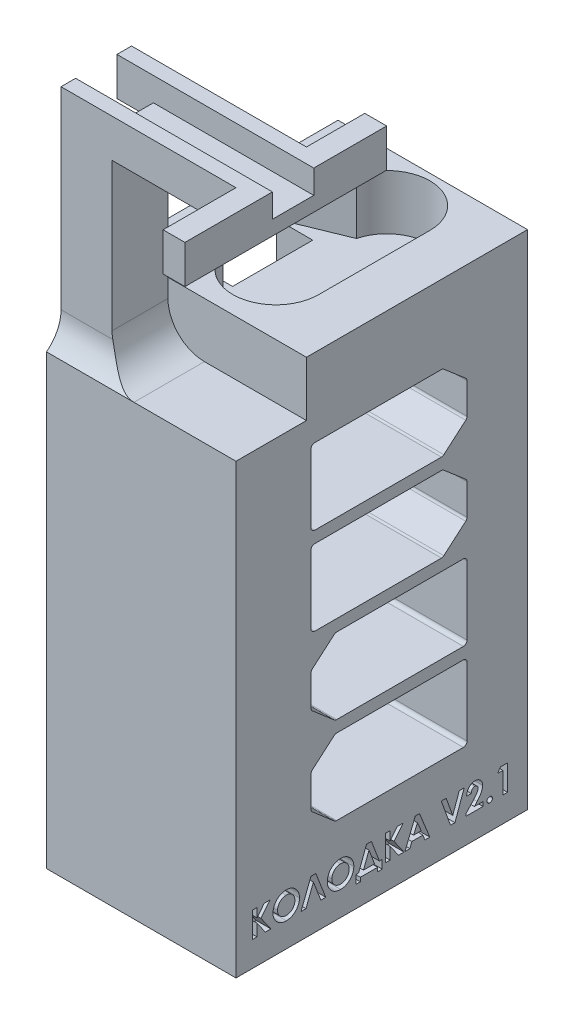
from build123d import *
from OCP.BRepAlgoAPI import BRepAlgoAPI_Cut
from OCP.TopTools import TopTools_ListOfShape

# Parameters (mm, degrees)
SKETCH_1_W          = 40
SKETCH_1_H          = 52.4
EXTRUDE_1_DEPTH     = 26
CUT_EXTRUDE_1_DEPTH = 5
CUT_EXTRUDE_2_DEPTH = 5
SKETCH_4_W          = 26
SKETCH_4_H          = 40
EXTRUDE_2_DEPTH     = 9
SKETCH_5_W          = 0.929999766
SKETCH_5_H          = 1.6
CUT_EXTRUDE_3_DEPTH = 5
CUT_EXTRUDE_4_DEPTH = 2
SKETCH_7_W          = 10.999999036
SKETCH_7_H          = 39.2
CUT_EXTRUDE_5_DEPTH = 5
SKETCH_8_W          = 10.07
SKETCH_8_H          = 9.796681171
CUT_EXTRUDE_6_DEPTH = 5
CUT_EXTRUDE_7_DEPTH = 5
EXTRUDE_3_DEPTH     = 7.52
SKETCH_12_W         = 3
SKETCH_12_H         = 59.4
EXTRUDE_4_DEPTH     = 5
EXTRUDE_5_DEPTH     = 27.25
FILLET_1_R          = 5
SKETCH_14_W         = 27
SKETCH_14_H         = 3.25
EXTRUDE_6_DEPTH     = 2
SKETCH_15_W         = 10
SKETCH_15_H         = 5.25
EXTRUDE_7_DEPTH     = 3
EXTRUDE_9_DEPTH     = 2
SKETCH_17_W         = 24
SKETCH_17_H         = 5.25
EXTRUDE_10_DEPTH    = 2


with BuildPart() as part:
    # Эскиз1 → Бобышка-Вытянуть1 (new body)
    with BuildSketch(Plane(origin=(0, 0, 0), x_dir=(0, 0, -1), z_dir=(1, 0, 0))):
        Rectangle(SKETCH_1_W, SKETCH_1_H)
        with BuildLine():
            Line((11.7, -10.900000099), (11.7, -1.500000099))
            ThreePointArc((11.7, -1.500000099), (11.553553391, -1.146446709), (11.2, -1.000000099))
            Line((11.2, -1.000000099), (-6.188803539, -1.000000099))
            ThreePointArc((-6.188803539, -1.000000099), (-6.362578004, -1.031169175), (-6.514686911, -1.120790358))
            Line((-6.514686911, -1.120790358), (-9.525883367, -3.708537312))
            ThreePointArc((-9.525883367, -3.708537312), (-9.654390627, -3.879110638), (-9.699999995, -4.087747071))
            Line((-9.699999995, -4.087747071), (-9.699999856, -8.312253158))
            ThreePointArc((-9.699999856, -8.312253158), (-9.654390483, -8.520889567), (-9.525883236, -8.691462875))
            Line((-9.525883236, -8.691462875), (-6.514686916, -11.279209833))
            ThreePointArc((-6.514686916, -11.279209833), (-6.362578006, -11.368831022), (-6.188803535, -11.400000099))
            Line((-6.188803535, -11.400000099), (11.2, -11.400000099))
            ThreePointArc((11.2, -11.400000099), (11.553553391, -11.25355349), (11.7, -10.900000099))
        make_face(mode=Mode.SUBTRACT)
        with BuildLine():
            Line((11.7, -22.9), (11.7, -13.5))
            ThreePointArc((11.7, -13.5), (11.553553391, -13.146446609), (11.2, -13))
            Line((11.2, -13), (-6.188803539, -13))
            ThreePointArc((-6.188803539, -13), (-6.362578004, -13.031169076), (-6.514686911, -13.120790258))
            Line((-6.514686911, -13.120790258), (-9.525883367, -15.708537213))
            ThreePointArc((-9.525883367, -15.708537213), (-9.654390627, -15.879110539), (-9.699999995, -16.087746971))
            Line((-9.699999995, -16.087746971), (-9.699999856, -20.312253058))
            ThreePointArc((-9.699999856, -20.312253058), (-9.654390483, -20.520889467), (-9.525883236, -20.691462776))
            Line((-9.525883236, -20.691462776), (-6.514686916, -23.279209734))
            ThreePointArc((-6.514686916, -23.279209734), (-6.362578006, -23.368830922), (-6.188803535, -23.4))
            Line((-6.188803535, -23.4), (11.2, -23.4))
            ThreePointArc((11.2, -23.4), (11.553553391, -23.253553391), (11.7, -22.9))
        make_face(mode=Mode.SUBTRACT)
        with BuildLine():
            Line((-9.699999995, 10.5), (-9.699999995, 1.1))
            ThreePointArc((-9.699999995, 1.1), (-9.553553386, 0.746446609), (-9.199999995, 0.6))
            Line((-9.199999995, 0.6), (8.188803544, 0.6))
            ThreePointArc((8.188803544, 0.6), (8.362578009, 0.631169076), (8.514686915, 0.720790258))
            Line((8.514686915, 0.720790258), (11.525883372, 3.308537213))
            ThreePointArc((11.525883372, 3.308537213), (11.654390632, 3.479110539), (11.7, 3.687746971))
            Line((11.7, 3.687746971), (11.69999986, 7.912253058))
            ThreePointArc((11.69999986, 7.912253058), (11.654390487, 8.120889467), (11.52588324, 8.291462776))
            Line((11.52588324, 8.291462776), (8.51468692, 10.879209734))
            ThreePointArc((8.51468692, 10.879209734), (8.36257801, 10.968830922), (8.18880354, 11))
            Line((8.18880354, 11), (-9.199999995, 11))
            ThreePointArc((-9.199999995, 11), (-9.553553386, 10.853553391), (-9.699999995, 10.5))
        make_face(mode=Mode.SUBTRACT)
        with BuildLine():
            Line((-9.699999995, 22.5), (-9.699999995, 13.1))
            ThreePointArc((-9.699999995, 13.1), (-9.553553386, 12.746446609), (-9.199999995, 12.6))
            Line((-9.199999995, 12.6), (8.188803544, 12.6))
            ThreePointArc((8.188803544, 12.6), (8.362578009, 12.631169076), (8.514686915, 12.720790258))
            Line((8.514686915, 12.720790258), (11.525883372, 15.308537213))
            ThreePointArc((11.525883372, 15.308537213), (11.654390632, 15.479110539), (11.7, 15.687746971))
            Line((11.7, 15.687746971), (11.69999986, 19.912253058))
            ThreePointArc((11.69999986, 19.912253058), (11.654390487, 20.120889467), (11.52588324, 20.291462776))
            Line((11.52588324, 20.291462776), (8.51468692, 22.879209734))
            ThreePointArc((8.51468692, 22.879209734), (8.36257801, 22.968830922), (8.18880354, 23))
            Line((8.18880354, 23), (-9.199999995, 23))
            ThreePointArc((-9.199999995, 23), (-9.553553386, 22.853553391), (-9.699999995, 22.5))
        make_face(mode=Mode.SUBTRACT)
    extrude(amount=EXTRUDE_1_DEPTH)

    # Эскиз2 → Вырез-Вытянуть1 (cut)
    with BuildSketch(Plane.ZY):
        with BuildLine():
            Line((-0.53499914, 17.800000005), (-0.535000075, -18.199999704))
            ThreePointArc((-0.535000075, -18.199999704), (4.500000262, -23.235000302), (9.53500086, -18.199999965))
            Line((9.53500086, -18.199999965), (9.535001795, 17.799999744))
            ThreePointArc((9.535001795, 17.799999744), (4.500001458, 22.835000342), (-0.53499914, 17.800000005))
        make_face()
    extrude(amount=-CUT_EXTRUDE_1_DEPTH, mode=Mode.SUBTRACT)

    # Эскиз3 → Вырез-Вытянуть2 (cut)
    with BuildSketch(Plane.ZY):
        with BuildLine():
            Line((-1.464999533, 5.799999501), (-1.464998168, 26.399999667))
            Line((-1.464998168, 26.399999667), (-11.534998963, 26.400000333))
            Line((-11.534998963, 26.400000333), (-11.535000327, 5.800000168))
            ThreePointArc((-11.535000327, 5.800000168), (-6.500000264, 0.764999437), (-1.464999533, 5.799999501))
        make_face()
    extrude(amount=-CUT_EXTRUDE_2_DEPTH, mode=Mode.SUBTRACT)

    # Эскиз4 → Бобышка-Вытянуть2 (add)
    with BuildSketch(Plane.XZ.offset(26.2)):
        with Locations((13, 0)):
            Rectangle(SKETCH_4_W, SKETCH_4_H)
    extrude(amount=EXTRUDE_2_DEPTH)

    # Эскиз5 → Вырез-Вытянуть3 (cut)
    with BuildSketch(Plane.ZY):
        with Locations((-0.999999199, 11.8)):
            Rectangle(SKETCH_5_W, SKETCH_5_H)
    extrude(amount=-CUT_EXTRUDE_3_DEPTH, mode=Mode.SUBTRACT)

    # Эскиз6 → Вырез-Вытянуть4 (cut)
    # profile 1 of 11: a face of its own
    with BuildSketch(Plane(origin=(26, 0, 0), x_dir=(0, 0, -1), z_dir=(1, 0, 0))):
        Polygon((-17.746794872, -28.261895698), (-17.118589744, -28.261895698), (-17.118589744, -29.493766691), (-16.125801282, -28.261895698), (-15.332832532, -28.261895698), (-16.580128205, -29.809972621), (-15.211538462, -31.761895698), (-15.968048878, -31.761895698), (-17.118589744, -30.120569576), (-17.118589744, -31.761895698), (-17.746794872, -31.761895698), align=None)
    # profile 2 of 11: a face of its own
    with BuildSketch(Plane(origin=(26, 0, 0), x_dir=(0, 0, -1), z_dir=(1, 0, 0))):
        with BuildLine():
            add(Edge.make_bspline(
                [(-13.095552885, -28.172152108), (-13.034701095, -28.17372767), (-12.91456588, -28.176838186), (-12.737890331, -28.202766763), (-12.567630772, -28.245013662), (-12.403864195, -28.303739908), (-12.247000651, -28.380536106), (-12.096486831, -28.473225033), (-11.952861868, -28.583556136), (-11.817597516, -28.708955575), (-11.692588859, -28.845321988), (-11.584268785, -28.992144676), (-11.491897399, -29.145619316), (-11.415339748, -29.306157146), (-11.357026846, -29.474869969), (-11.316106272, -29.650897571), (-11.28981683, -29.834189875), (-11.286793139, -29.958986951), (-11.28525641, -30.022412525)],
                knots=[0, 0, 0, 0, 1.014329547, 2.002516266, 2.970391464, 3.935626869, 4.897733899, 5.877609409, 6.878433252, 7.912639331, 8.949961323, 9.958554974, 10.949718813, 11.932905612, 12.9188844, 13.919928257, 14.942845884, 16, 16, 16, 16], degree=3))
            add(Edge.make_bspline(
                [(-11.28525641, -30.022412525), (-11.28689296, -30.085123438), (-11.290117834, -30.208697305), (-11.315033021, -30.390300498), (-11.356642704, -30.564442478), (-11.413966573, -30.73151742), (-11.489135758, -30.890716068), (-11.579705801, -31.043054886), (-11.688066673, -31.187120131), (-11.810266027, -31.322834494), (-11.944796912, -31.446024399), (-12.087286475, -31.554585291), (-12.237076788, -31.646575693), (-12.393948606, -31.721953471), (-12.558238332, -31.780451388), (-12.729540152, -31.821725919), (-12.907843464, -31.846809285), (-13.029098364, -31.850013095), (-13.090645032, -31.851639287)],
                knots=[0, 0, 0, 0, 1.051557043, 2.072126891, 3.067553643, 4.050577992, 5.02905126, 6.015227836, 7.017913613, 8.04756643, 9.074058332, 10.072836633, 11.047628519, 12.017157415, 12.98668631, 13.966869689, 14.968021931, 16, 16, 16, 16], degree=3))
            add(Edge.make_bspline(
                [(-13.090645032, -31.851639287), (-13.155015467, -31.850180513), (-13.281494574, -31.847314219), (-13.466597313, -31.82005708), (-13.643941731, -31.778998307), (-13.812038033, -31.71772029), (-13.972598136, -31.641117616), (-14.124442358, -31.546776831), (-14.267519669, -31.43485384), (-14.401009355, -31.308215032), (-14.521951333, -31.1696444), (-14.628706352, -31.023256815), (-14.718756578, -30.870170551), (-14.792105307, -30.710313959), (-14.849930499, -30.544680509), (-14.890719601, -30.372261445), (-14.914814698, -30.193470292), (-14.918171005, -30.072031767), (-14.919871795, -30.010493454)],
                knots=[0, 0, 0, 0, 1.067978421, 2.098431617, 3.099715153, 4.085208694, 5.062210972, 6.048429807, 7.046490867, 8.072918869, 9.098532598, 10.095778865, 11.076610158, 12.041847152, 13.011192615, 13.984257998, 14.978533688, 16, 16, 16, 16], degree=3))
            add(Edge.make_bspline(
                [(-14.919871795, -30.010493454), (-14.919337989, -29.969093699), (-14.918277136, -29.886818403), (-14.905498047, -29.764890616), (-14.887099833, -29.645342695), (-14.859889747, -29.52865128), (-14.826836448, -29.413993167), (-14.784011229, -29.302435623), (-14.73526454, -29.192786906), (-14.678308624, -29.086342105), (-14.614979153, -28.9840806), (-14.545881062, -28.886484778), (-14.470840604, -28.794734714), (-14.39009951, -28.708227465), (-14.303379534, -28.627531649), (-14.21182139, -28.551504905), (-14.113649381, -28.482166773), (-14.011012185, -28.417823877), (-13.904488447, -28.359639713), (-13.794511815, -28.310115092), (-13.683348025, -28.266866085), (-13.569512079, -28.232732056), (-13.454223931, -28.204930246), (-13.336251961, -28.186544432), (-13.216661979, -28.173765697), (-13.136018388, -28.172691247), (-13.095552885, -28.172152108)],
                knots=[0, 0, 0, 0, 1.034744296, 2.056386356, 3.06226378, 4.057406941, 5.050368692, 6.043467995, 7.042652155, 8.049140477, 9.059438543, 10.048523776, 11.036952808, 12.020949711, 13.004946614, 13.997082645, 14.994316842, 16.007702937, 17.024872941, 18.026463647, 19.021641123, 20.005082605, 20.995858141, 21.984425357, 22.988620895, 24, 24, 24, 24], degree=3))
        make_face()
        with BuildLine():
            add(Edge.make_bspline(
                [(-13.10536859, -28.800357236), (-13.146321836, -28.801456104), (-13.227147156, -28.803624828), (-13.345703181, -28.820147578), (-13.459521152, -28.846536288), (-13.567970131, -28.884760011), (-13.671520144, -28.93340911), (-13.770354755, -28.992313597), (-13.863105308, -29.06349825), (-13.951008543, -29.143141482), (-14.03041465, -29.231882346), (-14.100572451, -29.326983273), (-14.15928323, -29.428285446), (-14.208453876, -29.534847793), (-14.245468474, -29.64786858), (-14.271832862, -29.7664625), (-14.288494172, -29.890833899), (-14.290594351, -29.97561772), (-14.291666667, -30.018906916)],
                knots=[0, 0, 0, 0, 1.033739768, 2.040188636, 3.016340934, 3.979330865, 4.937572243, 5.900995986, 6.878200029, 7.884839167, 8.891893314, 9.879764717, 10.863503415, 11.843163062, 12.837761627, 13.859916423, 14.907309254, 16, 16, 16, 16], degree=3))
            add(Edge.make_bspline(
                [(-14.291666667, -30.018906916), (-14.290244939, -30.066881082), (-14.287458589, -30.160902499), (-14.267853492, -30.298058409), (-14.234311122, -30.427588554), (-14.185876592, -30.54885942), (-14.125805067, -30.66321763), (-14.051205768, -30.769261561), (-13.963286849, -30.867626156), (-13.895554827, -30.925055503), (-13.861177885, -30.95420339)],
                knots=[0, 0, 0, 0, 1.078454662, 2.113592447, 3.107694534, 4.079536787, 5.043276885, 6.005368276, 6.987637804, 8, 8, 8, 8], degree=3))
            add(Edge.make_bspline(
                [(-13.861177885, -30.95420339), (-13.833016606, -30.975736729), (-13.777328527, -31.018318258), (-13.68843823, -31.072895223), (-13.596898726, -31.119673127), (-13.502019237, -31.157469119), (-13.404000142, -31.187198812), (-13.302854884, -31.208018026), (-13.198726775, -31.221083884), (-13.128310469, -31.222645502), (-13.092748397, -31.223434159)],
                knots=[0, 0, 0, 0, 1.023928204, 2.024787132, 3.009472467, 3.9914905, 4.972207045, 5.96565515, 6.972602802, 8, 8, 8, 8], degree=3))
            add(Edge.make_bspline(
                [(-13.092748397, -31.223434159), (-13.052499343, -31.222325974), (-12.973308063, -31.220145586), (-12.856959023, -31.20382624), (-12.745493108, -31.176208015), (-12.638218329, -31.138319604), (-12.535444019, -31.089059674), (-12.437672464, -31.028328154), (-12.344732243, -30.956870748), (-12.256940996, -30.876181626), (-12.176695647, -30.787091185), (-12.106684251, -30.691483), (-12.046106762, -30.591463604), (-11.997958621, -30.485617376), (-11.95948166, -30.374943453), (-11.93343458, -30.258951685), (-11.916632521, -30.138120235), (-11.91453175, -30.055890162), (-11.913461538, -30.013999063)],
                knots=[0, 0, 0, 0, 1.026359118, 2.019393844, 2.989460624, 3.950973911, 4.916101784, 5.890408035, 6.881132271, 7.902007068, 8.92769091, 9.933912415, 10.920395702, 11.90457117, 12.894218921, 13.903490204, 14.931958862, 16, 16, 16, 16], degree=3))
            add(Edge.make_bspline(
                [(-11.913461538, -30.013999063), (-11.91456878, -29.972348849), (-11.916748215, -29.890366755), (-11.933096284, -29.769845961), (-11.960539361, -29.654366263), (-11.998541547, -29.54373907), (-12.047068327, -29.437855927), (-12.107076612, -29.337089181), (-12.178355842, -29.241536249), (-12.25926553, -29.151848288), (-12.347330752, -29.069430796), (-12.441877568, -28.997907396), (-12.54026045, -28.935755835), (-12.644736783, -28.887068811), (-12.753169069, -28.848279963), (-12.866218966, -28.819715299), (-12.984314658, -28.803740902), (-13.0646576, -28.801495178), (-13.10536859, -28.800357236)],
                knots=[0, 0, 0, 0, 1.055025985, 2.07665775, 3.074803781, 4.057872707, 5.035505728, 6.020516407, 7.023567878, 8.050795229, 9.077271434, 10.074415901, 11.050397877, 12.019801805, 12.988065821, 13.964604439, 14.968634123, 16, 16, 16, 16], degree=3))
        make_face(mode=Mode.SUBTRACT)
    # profile 3 of 11: a face of its own
    with BuildSketch(Plane(origin=(26, 0, 0), x_dir=(0, 0, -1), z_dir=(1, 0, 0))):
        Polygon((-8.354567308, -31.761895698), (-9.378205128, -29.110954191), (-10.402544071, -31.761895698), (-11.072115385, -31.761895698), (-9.71474359, -28.261895698), (-9.042367788, -28.261895698), (-7.684294872, -31.761895698), align=None)
    # profile 4 of 11: a face of its own
    with BuildSketch(Plane(origin=(26, 0, 0), x_dir=(0, 0, -1), z_dir=(1, 0, 0))):
        with BuildLine():
            add(Edge.make_bspline(
                [(-5.646834936, -28.172152108), (-5.585983146, -28.17372767), (-5.465847931, -28.176838186), (-5.289172382, -28.202766763), (-5.118912824, -28.245013662), (-4.955146246, -28.303739908), (-4.798282702, -28.380536106), (-4.647768883, -28.473225033), (-4.50414392, -28.583556136), (-4.368879567, -28.708955575), (-4.24387091, -28.845321988), (-4.135550836, -28.992144676), (-4.043179451, -29.145619316), (-3.966621799, -29.306157146), (-3.908308898, -29.474869969), (-3.867388323, -29.650897571), (-3.841098881, -29.834189875), (-3.838075191, -29.958986951), (-3.836538462, -30.022412525)],
                knots=[0, 0, 0, 0, 1.014329547, 2.002516266, 2.970391464, 3.935626869, 4.897733899, 5.877609409, 6.878433252, 7.912639331, 8.949961323, 9.958554974, 10.949718813, 11.932905612, 12.9188844, 13.919928257, 14.942845884, 16, 16, 16, 16], degree=3))
            add(Edge.make_bspline(
                [(-3.836538462, -30.022412525), (-3.838175011, -30.085123438), (-3.841399886, -30.208697305), (-3.866315073, -30.390300498), (-3.907924755, -30.564442478), (-3.965248624, -30.73151742), (-4.040417809, -30.890716068), (-4.130987852, -31.043054886), (-4.239348724, -31.187120131), (-4.361548079, -31.322834494), (-4.496078963, -31.446024399), (-4.638568526, -31.554585291), (-4.788358839, -31.646575693), (-4.945230657, -31.721953471), (-5.109520384, -31.780451388), (-5.280822203, -31.821725919), (-5.459125516, -31.846809285), (-5.580380415, -31.850013095), (-5.641927083, -31.851639287)],
                knots=[0, 0, 0, 0, 1.051557043, 2.072126891, 3.067553643, 4.050577992, 5.02905126, 6.015227836, 7.017913613, 8.04756643, 9.074058332, 10.072836633, 11.047628519, 12.017157415, 12.98668631, 13.966869689, 14.968021931, 16, 16, 16, 16], degree=3))
            add(Edge.make_bspline(
                [(-5.641927083, -31.851639287), (-5.706297519, -31.850180513), (-5.832776625, -31.847314219), (-6.017879364, -31.82005708), (-6.195223782, -31.778998307), (-6.363320084, -31.71772029), (-6.523880187, -31.641117616), (-6.675724409, -31.546776831), (-6.81880172, -31.43485384), (-6.952291406, -31.308215032), (-7.073233384, -31.1696444), (-7.179988403, -31.023256815), (-7.27003863, -30.870170551), (-7.343387359, -30.710313959), (-7.40121255, -30.544680509), (-7.442001653, -30.372261445), (-7.466096749, -30.193470292), (-7.469453056, -30.072031767), (-7.471153846, -30.010493454)],
                knots=[0, 0, 0, 0, 1.067978421, 2.098431617, 3.099715153, 4.085208694, 5.062210972, 6.048429807, 7.046490867, 8.072918869, 9.098532598, 10.095778865, 11.076610158, 12.041847152, 13.011192615, 13.984257998, 14.978533688, 16, 16, 16, 16], degree=3))
            add(Edge.make_bspline(
                [(-7.471153846, -30.010493454), (-7.47062004, -29.969093699), (-7.469559187, -29.886818403), (-7.456780098, -29.764890616), (-7.438381884, -29.645342695), (-7.411171798, -29.52865128), (-7.378118499, -29.413993167), (-7.33529328, -29.302435623), (-7.286546592, -29.192786906), (-7.229590676, -29.086342105), (-7.166261205, -28.9840806), (-7.097163113, -28.886484778), (-7.022122655, -28.794734714), (-6.941381561, -28.708227465), (-6.854661585, -28.627531649), (-6.763103441, -28.551504905), (-6.664931432, -28.482166773), (-6.562294236, -28.417823877), (-6.455770498, -28.359639713), (-6.345793866, -28.310115092), (-6.234630076, -28.266866085), (-6.12079413, -28.232732056), (-6.005505982, -28.204930246), (-5.887534013, -28.186544432), (-5.767944031, -28.173765697), (-5.687300439, -28.172691247), (-5.646834936, -28.172152108)],
                knots=[0, 0, 0, 0, 1.034744296, 2.056386356, 3.06226378, 4.057406941, 5.050368692, 6.043467995, 7.042652155, 8.049140477, 9.059438543, 10.048523776, 11.036952808, 12.020949711, 13.004946614, 13.997082645, 14.994316842, 16.007702937, 17.024872941, 18.026463647, 19.021641123, 20.005082605, 20.995858141, 21.984425357, 22.988620895, 24, 24, 24, 24], degree=3))
        make_face()
        with BuildLine():
            add(Edge.make_bspline(
                [(-5.656650641, -28.800357236), (-5.697603887, -28.801456104), (-5.778429207, -28.803624828), (-5.896985232, -28.820147578), (-6.010803203, -28.846536288), (-6.119252182, -28.884760011), (-6.222802196, -28.93340911), (-6.321636807, -28.992313597), (-6.41438736, -29.06349825), (-6.502290594, -29.143141482), (-6.581696701, -29.231882346), (-6.651854502, -29.326983273), (-6.710565282, -29.428285446), (-6.759735927, -29.534847793), (-6.796750525, -29.64786858), (-6.823114914, -29.7664625), (-6.839776223, -29.890833899), (-6.841876402, -29.97561772), (-6.842948718, -30.018906916)],
                knots=[0, 0, 0, 0, 1.033739768, 2.040188636, 3.016340934, 3.979330865, 4.937572243, 5.900995986, 6.878200029, 7.884839167, 8.891893314, 9.879764717, 10.863503415, 11.843163062, 12.837761627, 13.859916423, 14.907309254, 16, 16, 16, 16], degree=3))
            add(Edge.make_bspline(
                [(-6.842948718, -30.018906916), (-6.841526991, -30.066881082), (-6.838740641, -30.160902499), (-6.819135543, -30.298058409), (-6.785593173, -30.427588554), (-6.737158643, -30.54885942), (-6.677087119, -30.66321763), (-6.602487819, -30.769261561), (-6.514568901, -30.867626156), (-6.446836878, -30.925055503), (-6.412459936, -30.95420339)],
                knots=[0, 0, 0, 0, 1.078454662, 2.113592447, 3.107694534, 4.079536787, 5.043276885, 6.005368276, 6.987637804, 8, 8, 8, 8], degree=3))
            add(Edge.make_bspline(
                [(-6.412459936, -30.95420339), (-6.384298657, -30.975736729), (-6.328610579, -31.018318258), (-6.239720281, -31.072895223), (-6.148180777, -31.119673127), (-6.053301288, -31.157469119), (-5.955282193, -31.187198812), (-5.854136935, -31.208018026), (-5.750008827, -31.221083884), (-5.67959252, -31.222645502), (-5.644030449, -31.223434159)],
                knots=[0, 0, 0, 0, 1.023928204, 2.024787132, 3.009472467, 3.9914905, 4.972207045, 5.96565515, 6.972602802, 8, 8, 8, 8], degree=3))
            add(Edge.make_bspline(
                [(-5.644030449, -31.223434159), (-5.603781395, -31.222325974), (-5.524590115, -31.220145586), (-5.408241074, -31.20382624), (-5.296775159, -31.176208015), (-5.189500381, -31.138319604), (-5.086726071, -31.089059674), (-4.988954515, -31.028328154), (-4.896014294, -30.956870748), (-4.808223048, -30.876181626), (-4.727977698, -30.787091185), (-4.657966302, -30.691483), (-4.597388813, -30.591463604), (-4.549240672, -30.485617376), (-4.510763711, -30.374943453), (-4.484716632, -30.258951685), (-4.467914572, -30.138120235), (-4.465813801, -30.055890162), (-4.46474359, -30.013999063)],
                knots=[0, 0, 0, 0, 1.026359118, 2.019393844, 2.989460624, 3.950973911, 4.916101784, 5.890408035, 6.881132271, 7.902007068, 8.92769091, 9.933912415, 10.920395702, 11.90457117, 12.894218921, 13.903490204, 14.931958862, 16, 16, 16, 16], degree=3))
            add(Edge.make_bspline(
                [(-4.46474359, -30.013999063), (-4.465850831, -29.972348849), (-4.468030266, -29.890366755), (-4.484378335, -29.769845961), (-4.511821412, -29.654366263), (-4.549823599, -29.54373907), (-4.598350378, -29.437855927), (-4.658358663, -29.337089181), (-4.729637894, -29.241536249), (-4.810547581, -29.151848288), (-4.898612803, -29.069430796), (-4.993159619, -28.997907396), (-5.091542502, -28.935755835), (-5.196018835, -28.887068811), (-5.30445112, -28.848279963), (-5.417501017, -28.819715299), (-5.53559671, -28.803740902), (-5.615939651, -28.801495178), (-5.656650641, -28.800357236)],
                knots=[0, 0, 0, 0, 1.055025985, 2.07665775, 3.074803781, 4.057872707, 5.035505728, 6.020516407, 7.023567878, 8.050795229, 9.077271434, 10.074415901, 11.050397877, 12.019801805, 12.988065821, 13.964604439, 14.968634123, 16, 16, 16, 16], degree=3))
        make_face(mode=Mode.SUBTRACT)
    # profile 5 of 11: a face of its own
    with BuildSketch(Plane(origin=(26, 0, 0), x_dir=(0, 0, -1), z_dir=(1, 0, 0))):
        Polygon((-2.086538462, -28.261895698), (-1.416967147, -28.261895698), (-0.325320513, -31.133690569), (0.067307692, -31.133690569), (0.067307692, -32.300357236), (-0.560897436, -32.300357236), (-0.560897436, -31.761895698), (-2.939102564, -31.761895698), (-2.939102564, -32.300357236), (-3.567307692, -32.300357236), (-3.567307692, -31.133690569), (-3.174679487, -31.133690569), align=None)
        Polygon((-1.75, -29.12988448), (-2.506510417, -31.133690569), (-0.994190705, -31.133690569), align=None, mode=Mode.SUBTRACT)
    # profile 6 of 11: a face of its own
    with BuildSketch(Plane(origin=(26, 0, 0), x_dir=(0, 0, -1), z_dir=(1, 0, 0))):
        Polygon((0.516025641, -28.261895698), (1.144230769, -28.261895698), (1.144230769, -29.493766691), (2.137019231, -28.261895698), (2.929987981, -28.261895698), (1.682692308, -29.809972621), (3.051282051, -31.761895698), (2.294771635, -31.761895698), (1.144230769, -30.120569576), (1.144230769, -31.761895698), (0.516025641, -31.761895698), align=None)
    # profile 7 of 11: a face of its own
    with BuildSketch(Plane(origin=(26, 0, 0), x_dir=(0, 0, -1), z_dir=(1, 0, 0))):
        Polygon((4.600060096, -28.261895698), (5.182692308, -28.261895698), (6.596153846, -31.761895698), (5.925180288, -31.761895698), (5.653145032, -31.04394698), (4.128205128, -31.04394698), (3.856169872, -31.761895698), (3.185897436, -31.761895698), align=None)
        Polygon((4.891025641, -29.200697781), (4.366586538, -30.415741851), (5.415464744, -30.415741851), align=None, mode=Mode.SUBTRACT)
    # profile 8 of 11: a face of its own
    with BuildSketch(Plane(origin=(26, 0, 0), x_dir=(0, 0, -1), z_dir=(1, 0, 0))):
        Polygon((8.166666667, -28.261895698), (8.837640224, -28.261895698), (9.737179487, -30.748073582), (10.638822115, -28.261895698), (11.307692308, -28.261895698), (10.038661859, -31.761895698), (9.43359375, -31.761895698), align=None)
    # profile 9 of 11: a face of its own
    with BuildSketch(Plane(origin=(26, 0, 0), x_dir=(0, 0, -1), z_dir=(1, 0, 0))):
        with BuildLine():
            Line((12.272435897, -29.428562364), (11.644230769, -29.428562364))
            add(Edge.make_bspline(
                [(11.644230769, -29.428562364), (11.646943891, -29.38104197), (11.652245168, -29.288189972), (11.673332306, -29.153319472), (11.701588349, -29.025881681), (11.739299789, -28.906322389), (11.78668668, -28.794685042), (11.842529636, -28.69058906), (11.908255319, -28.594582511), (11.982464868, -28.507128394), (12.06389841, -28.428672499), (12.150865304, -28.359108573), (12.244695828, -28.301706172), (12.343675619, -28.254469311), (12.447787824, -28.216729253), (12.558017508, -28.191496971), (12.673410243, -28.174409422), (12.752405914, -28.172914193), (12.792668269, -28.172152108)],
                knots=[0, 0, 0, 0, 1.199038563, 2.342849363, 3.436047546, 4.486744587, 5.497670872, 6.488682221, 7.459191391, 8.424610317, 9.374430501, 10.305433194, 11.225809216, 12.140057399, 13.06607119, 14.010487599, 14.985989317, 16, 16, 16, 16], degree=3))
            add(Edge.make_bspline(
                [(12.792668269, -28.172152108), (12.842089739, -28.173694188), (12.938572029, -28.17670469), (13.07876845, -28.202385269), (13.209696578, -28.245340007), (13.331261242, -28.305359104), (13.442427539, -28.381607075), (13.543177036, -28.472520301), (13.630462907, -28.580006191), (13.70483857, -28.69959243), (13.766635856, -28.826217428), (13.809940821, -28.957152926), (13.838404708, -29.088924427), (13.841440557, -29.177652687), (13.842948718, -29.221731435)],
                knots=[0, 0, 0, 0, 1.075374347, 2.099382735, 3.09057751, 4.06680945, 5.040638231, 6.016817125, 7.011024321, 8.044445721, 9.0776792, 10.070479129, 11.0414456, 12, 12, 12, 12], degree=3))
            add(Edge.make_bspline(
                [(13.842948718, -29.221731435), (13.84236152, -29.248393377), (13.841179635, -29.30205728), (13.832961835, -29.383263937), (13.82063351, -29.465982411), (13.8020454, -29.550141779), (13.778864503, -29.635765632), (13.750742725, -29.723110214), (13.717027753, -29.811680311), (13.678282222, -29.902472766), (13.632058705, -29.995782347), (13.578237844, -30.093007799), (13.515391112, -30.194062876), (13.444277619, -30.299518169), (13.364551982, -30.409207358), (13.275825008, -30.522800024), (13.179118624, -30.640696433), (13.110483382, -30.719503566), (13.075220353, -30.759992653)],
                knots=[0, 0, 0, 0, 0.728284026, 1.46585585, 2.227944881, 3.01186502, 3.81876927, 4.650621989, 5.517437689, 6.406905708, 7.346299482, 8.360816762, 9.441613733, 10.596154504, 11.834900912, 13.145207542, 14.533280747, 16, 16, 16, 16], degree=3))
            Line((13.075220353, -30.759992653), (12.709935897, -31.178562364))
            Line((12.709935897, -31.178562364), (13.887820513, -31.178562364))
            Line((13.887820513, -31.178562364), (13.887820513, -31.761895698))
            Line((13.887820513, -31.761895698), (11.554487179, -31.761895698))
            Line((11.554487179, -31.761895698), (11.554487179, -31.443586403))
            Line((11.554487179, -31.443586403), (12.590745192, -30.340721819))
            add(Edge.make_bspline(
                [(12.590745192, -30.340721819), (12.620747525, -30.308550917), (12.678853145, -30.24624542), (12.761531455, -30.154743168), (12.836348022, -30.067909716), (12.901751464, -29.984820461), (12.96117407, -29.908170481), (13.011966189, -29.835649451), (13.05459253, -29.767912986), (13.100869469, -29.686234639), (13.144817349, -29.588818676), (13.185142188, -29.476591492), (13.209722969, -29.369328151), (13.213115894, -29.299433052), (13.21474359, -29.265902108)],
                knots=[0, 0, 0, 0, 1.246127091, 2.413378631, 3.493388633, 4.492180848, 5.408488754, 6.240484944, 6.999099869, 7.674939598, 8.898438119, 10.020720584, 11.050475521, 12, 12, 12, 12], degree=3))
            add(Edge.make_bspline(
                [(13.21474359, -29.265902108), (13.213526601, -29.233463506), (13.211168489, -29.170608515), (13.185254756, -29.081197625), (13.145108302, -29.000245191), (13.088536278, -28.930170164), (13.020009838, -28.872584867), (12.9408211, -28.829754541), (12.851615686, -28.805041639), (12.78908099, -28.801948467), (12.756911058, -28.800357236)],
                knots=[0, 0, 0, 0, 1.062038974, 2.057870785, 3.028805853, 4.01125022, 4.991535629, 5.949134679, 6.94496649, 8, 8, 8, 8], degree=3))
            add(Edge.make_bspline(
                [(12.756911058, -28.800357236), (12.740291661, -28.800945056), (12.707573709, -28.802102274), (12.659480877, -28.809805559), (12.613717092, -28.823381794), (12.569772978, -28.841572039), (12.528117518, -28.86568334), (12.48885578, -28.895404359), (12.451574092, -28.929979819), (12.416443443, -28.969301605), (12.384469967, -29.013184731), (12.356071241, -29.061228412), (12.332590224, -29.113402828), (12.311916682, -29.169019196), (12.295972257, -29.22867488), (12.284362738, -29.29201285), (12.275536796, -29.358930061), (12.273488334, -29.404929352), (12.272435897, -29.428562364)],
                knots=[0, 0, 0, 0, 0.903469896, 1.778625579, 2.63899355, 3.493148037, 4.358286772, 5.247621495, 6.164656832, 7.118446693, 8.109501108, 9.111810964, 10.146451449, 11.215617525, 12.33435995, 13.498009769, 14.714554818, 16, 16, 16, 16], degree=3))
        make_face()
    # profile 10 of 11: a face of its own
    with BuildSketch(Plane(origin=(26, 0, 0), x_dir=(0, 0, -1), z_dir=(1, 0, 0))):
        with BuildLine():
            add(Edge.make_bspline(
                [(14.807692308, -31.04394698), (14.833052204, -31.045337402), (14.88298146, -31.048074903), (14.955122426, -31.068504588), (15.020230064, -31.105209426), (15.078444992, -31.153084527), (15.127670069, -31.210684665), (15.163248841, -31.27637058), (15.185404635, -31.348233578), (15.18785065, -31.398319917), (15.189102564, -31.423954993)],
                knots=[0, 0, 0, 0, 1.016957001, 2.002212695, 2.9757545, 3.99499976, 5.013036768, 5.994806404, 6.97370641, 8, 8, 8, 8], degree=3))
            add(Edge.make_bspline(
                [(15.189102564, -31.423954993), (15.187858851, -31.449594185), (15.18542886, -31.499688568), (15.163095525, -31.571691596), (15.127723235, -31.637917389), (15.078441042, -31.696134751), (15.020471152, -31.744912103), (14.954972732, -31.781278469), (14.883118887, -31.802867078), (14.833076393, -31.805454846), (14.807692308, -31.806767493)],
                knots=[0, 0, 0, 0, 1.023218912, 1.999186227, 2.986238111, 4.008388923, 5.030539734, 6.0011649, 6.986089706, 8, 8, 8, 8], degree=3))
            add(Edge.make_bspline(
                [(14.807692308, -31.806767493), (14.782302208, -31.80546552), (14.732247856, -31.802898795), (14.660282319, -31.781096499), (14.594300339, -31.745154899), (14.536315883, -31.696075584), (14.48681352, -31.638123542), (14.452446897, -31.571482642), (14.429905533, -31.499715714), (14.427508761, -31.449603375), (14.426282051, -31.423954993)],
                knots=[0, 0, 0, 0, 1.013427518, 1.99788335, 2.976245624, 3.997909735, 5.019573847, 6.001765691, 6.977268297, 8, 8, 8, 8], degree=3))
            add(Edge.make_bspline(
                [(14.426282051, -31.423954993), (14.427516855, -31.398310567), (14.429929439, -31.348205959), (14.452294018, -31.276581941), (14.486868599, -31.210477393), (14.536311755, -31.153143817), (14.594542669, -31.104968526), (14.660131785, -31.068684065), (14.732385214, -31.048042952), (14.782326368, -31.04532664), (14.807692308, -31.04394698)],
                knots=[0, 0, 0, 0, 1.025808215, 2.00424526, 2.981110158, 3.998665696, 5.017428914, 5.998734231, 6.983523959, 8, 8, 8, 8], degree=3))
        make_face()
    # profile 11 of 11: a face of its own
    with BuildSketch(Plane(origin=(26, 0, 0), x_dir=(0, 0, -1), z_dir=(1, 0, 0))):
        Polygon((16.282151442, -28.261895698), (17.253205128, -28.261895698), (17.253205128, -31.761895698), (16.625, -31.761895698), (16.625, -28.845229031), (15.907051282, -28.845229031), align=None)
    extrude(amount=-CUT_EXTRUDE_4_DEPTH, mode=Mode.SUBTRACT)


with BuildPart() as cut_extrude_5_tool:
    # Эскиз7 → Вырез-Вытянуть5 (new body)
    with BuildSketch(Plane.ZY):
        with Locations((-6.034999458, 6.6)):
            Rectangle(SKETCH_7_W, SKETCH_7_H)
    extrude(amount=-CUT_EXTRUDE_5_DEPTH)


with BuildPart() as part_1:
    add(part.part)

    # Вырез-Вытянуть5: cut by cut_extrude_5_tool, with a tolerance
    cut_extrude_5_stock = TopTools_ListOfShape()
    cut_extrude_5_stock.Append(part_1.part.wrapped)
    cut_extrude_5_tools = TopTools_ListOfShape()
    cut_extrude_5_tools.Append(cut_extrude_5_tool.part.wrapped)
    cut_extrude_5_cut = BRepAlgoAPI_Cut()
    cut_extrude_5_cut.SetArguments(cut_extrude_5_stock)
    cut_extrude_5_cut.SetTools(cut_extrude_5_tools)
    cut_extrude_5_cut.SetFuzzyValue(0.00001)
    cut_extrude_5_cut.Build()
    add(Compound.cast(cut_extrude_5_cut.Shape()).solids(), mode=Mode.REPLACE)

    # Эскиз8 → Вырез-Вытянуть6 (cut)
    with BuildSketch(Plane.ZY):
        with Locations((-6.5, -25.501659415)):
            Rectangle(SKETCH_8_W, SKETCH_8_H)
    extrude(amount=-CUT_EXTRUDE_6_DEPTH, mode=Mode.SUBTRACT)

    # Эскиз9 → Вырез-Вытянуть7 (cut)
    with BuildSketch(Plane.ZY):
        Polygon((-10.835, -24.53), (-3.431035191, -24.53), (10.33, -24.53), (10.33, 26.2), (19, 26.2), (19, -24.53), (19, -33.2), (-3.431035191, -33.2), (-10.835, -33.2), align=None)
    extrude(amount=-CUT_EXTRUDE_7_DEPTH, mode=Mode.SUBTRACT)

    # Эскиз10 → Бобышка-Вытянуть3 (add)
    with BuildSketch(Plane(origin=(0, 26.2, 0), x_dir=(1, 0, 0), z_dir=(0, 1, 0))):
        with BuildLine():
            Line((0, -10.33), (26, -10.33))
            Line((26, -10.33), (26, 20))
            Line((26, 20), (0, 20))
            Line((0, 20), (0, 11.534998976))
            Line((0, 11.534998976), (7.8, 14.725194938))
            ThreePointArc((7.8, 14.725194938), (14.268114575, 19.051826637), (19.4, 13.202040316))
            Line((19.4, 13.202040316), (19.4, -2.035000865))
            ThreePointArc((19.4, -2.035000865), (14.268114575, -7.884787186), (7.8, -3.558155486))
            Line((7.8, -3.558155486), (0, 0.53499994))
            Line((0, 0.53499994), (0, -10.33))
        make_face()
    extrude(amount=EXTRUDE_3_DEPTH)

    # Эскиз12 → Бобышка-Вытянуть4 (add)
    with BuildSketch(Plane.ZY.offset(-5)):
        with Locations((17.5, -3.5)):
            Rectangle(SKETCH_12_W, SKETCH_12_H)
    extrude(amount=EXTRUDE_4_DEPTH)

    # Эскиз13 → Бобышка-Вытянуть5 (add)
    with BuildSketch(Plane(origin=(0, 26.2, 0), x_dir=(1, 0, 0), z_dir=(0, 1, 0))):
        Polygon((5, -16), (0, -16), (0, -18), (7, -18), (7, -10.33), (5, -10.33), align=None)
    extrude(amount=EXTRUDE_5_DEPTH)

    # Скругление1
    # the kernel refuses this fillet: 5 mm, written as the material it adds along each edge
    with BuildSketch(Plane(origin=(7, 26.2, 18), x_dir=(0, 1, 0), z_dir=(0, 0, -1))) as fillet_1_piece_1:
        with BuildLine():
            CenterArc((FILLET_1_R, FILLET_1_R), FILLET_1_R, 180, 90)
            Line((0, FILLET_1_R), (0, 0))
            Line((0, 0), (FILLET_1_R, 0))
        make_face()
    extrude(amount=7.67)
    with BuildSketch(Plane(origin=(0, 26.2, 18), x_dir=(0, 1, 0), z_dir=(1, 0, 0))) as fillet_1_piece_2:
        with BuildLine():
            CenterArc((4, 5), FILLET_1_R, 216.869897646, 53.130102354)
            Line((0, 2), (0, 0))
            Line((0, 0), (4, 0))
        make_face()
    extrude(amount=7)
    with BuildSketch(Plane(origin=(0, 26.2, 18), x_dir=(0, 1, 0), z_dir=(1, 0, 0))) as fillet_1_piece_3a_section:
        with BuildLine():
            CenterArc((4, 5), FILLET_1_R, 216.869897646, 53.130102354)
            Line((0, 2), (0, 0))
            Line((0, 0), (4, 0))
        make_face()
    fillet_1_piece_3a = extrude(amount=17, mode=Mode.PRIVATE)
    fillet_1_piece_3a = split(fillet_1_piece_3a, bisect_by=Plane(origin=(7, 26.2, 18), z_dir=(1, 0, 0)), keep=Keep.TOP, mode=Mode.PRIVATE)
    with BuildSketch(Plane(origin=(7, 26.2, 30.5), x_dir=(0, 1, 0), z_dir=(0, 0, -1))) as fillet_1_piece_3b_section:
        with BuildLine():
            CenterArc((FILLET_1_R, FILLET_1_R), FILLET_1_R, 180, 90)
            Line((0, FILLET_1_R), (0, 0))
            Line((0, 0), (FILLET_1_R, 0))
        make_face()
    fillet_1_piece_3b = extrude(amount=20.17, mode=Mode.PRIVATE)
    fillet_1_piece_3b = split(fillet_1_piece_3b, bisect_by=Plane(origin=(7, 26.2, 20), z_dir=(0, 0, -1)), keep=Keep.TOP, mode=Mode.PRIVATE)
    fillet_1_piece_3b = split(fillet_1_piece_3b, bisect_by=Plane(origin=(7, 26.2, 18), z_dir=(0, 0, 1)), keep=Keep.TOP, mode=Mode.PRIVATE)
    fillet_1_piece_3 = fillet_1_piece_3a & fillet_1_piece_3b
    add(fillet_1_piece_3)

    # Эскиз14 → Бобышка-Вытянуть6 (add)
    with BuildSketch(Plane.XY.offset(16)):
        with Locations((13.5, 55.075)):
            Rectangle(SKETCH_14_W, SKETCH_14_H)
    extrude(amount=EXTRUDE_6_DEPTH)

    # Эскиз15 → Бобышка-Вытянуть7 (add)
    with BuildSketch(Plane.ZY.offset(-27)):
        with Locations((23, 54.075)):
            Rectangle(SKETCH_15_W, SKETCH_15_H)
        with Locations((5.33, 54.075)):
            Rectangle(SKETCH_15_W, SKETCH_15_H)
    extrude(amount=EXTRUDE_7_DEPTH)


with BuildPart() as extrude_7_piece_1:
    # of the separate pieces the step leaves, piece 1, a body of its own (extrude_7_pieces)
    add(part_1.part.solids().sort_by_distance((7.101020514, 30.2, 18))[0])



with BuildPart() as extrude_7_piece_2:
    # of the separate pieces the step leaves, piece 2, a body of its own (extrude_7_pieces)
    add(part_1.part.solids().sort_by_distance((27, 56.7, 10.33))[0])


with BuildPart() as extrude_7_piece_1_1:
    add(extrude_7_piece_1.part)

    add(extrude_7_piece_2.part)  # Бобышка-Вытянуть9 merges Бобышка-Вытянуть7 piece 2
    # Эскиз16 → Бобышка-Вытянуть9 (add)
    with BuildSketch(Plane.XZ.offset(-53.45)):
        Polygon((7, 16), (7, 10.33), (27, 10.33), (27, 16), (27, 18), (7, 18), align=None)
    extrude(amount=EXTRUDE_9_DEPTH)

    # Эскиз17 → Бобышка-Вытянуть10 (add)
    with BuildSketch(Plane(origin=(0, 0, 10.33), x_dir=(-1, 0, 0), z_dir=(0, 0, -1))):
        with Locations((-12, 54.075)):
            Rectangle(SKETCH_17_W, SKETCH_17_H)
    extrude(amount=EXTRUDE_10_DEPTH)


solid = extrude_7_piece_1_1.part
